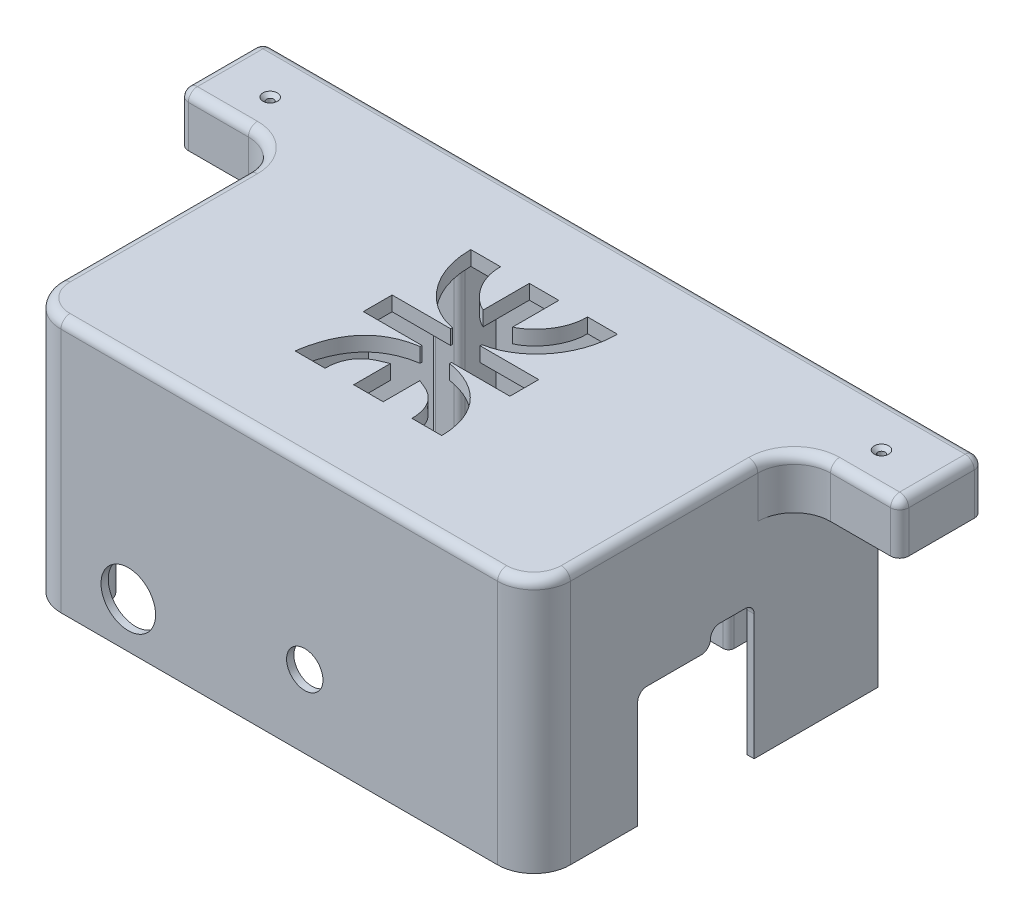
from build123d import *

# Parameters (mm, degrees)
SALIENTE_EXTRUIR1_DEPTH = 70
CORTAR_EXTRUIR1_START   = -70
CROQUIS2_W              = 29
CROQUIS2_H              = 23
CORTAR_EXTRUIR1_DEPTH   = 56
CROQUIS3_W              = 136
CROQUIS3_H              = 90.5
CORTAR_EXTRUIR2_DEPTH   = 66
REDONDEO5_R             = 10
REDONDEO13_R            = 2.5
REDONDEO14_R            = 10
REDONDEO15_R            = 10
CROQUIS7_W              = 15
CROQUIS7_H              = 13
CORTAR_EXTRUIR4_DEPTH   = 2
CORTAR_EXTRUIR5_DEPTH   = 140
REDONDEO16_R            = 2.5
REDONDEO17_R            = 2.5
CROQUIS9_R              = 7.5
CROQUIS9_R_2            = 5
CORTAR_EXTRUIR6_DEPTH   = 2
CROQUIS10_R             = 1
SALIENTE_EXTRUIR8_DEPTH = 66
CROQUIS10_4_R           = 1
CORTAR_EXTRUIR7_DEPTH   = 10
REDONDEO18_R            = 5
CROQUIS12_W             = 8.003042052
CROQUIS12_H             = 10
CROQUIS12_R             = 1
SALIENTE_EXTRUIR9_DEPTH = 66
CROQUIS12_3_R           = 1
CORTAR_EXTRUIR8_DEPTH   = 10
REDONDEO19_R            = 1.5
CORTAR_EXTRUIR9_REACH   = 136.7
CROQUIS13_R             = 1
REDONDEO20_R            = 2.5
CHAFL_N1_SIZE           = 1
CORTAR_EXTRUIR10_REACH  = 136.7


with BuildPart() as part:
    # Croquis1 → Saliente-Extruir1 (new body)
    with BuildSketch(Plane(origin=(0, 0, 0), x_dir=(1, 0, 0), z_dir=(0, 1, 0))):
        Polygon((-70, -35.821234201), (70, -35.821234201), (70, 35.678765799), (99, 35.678765799), (99, 58.678765799), (-99, 58.678765799), (-99, 35.678765799), (-70, 35.678765799), align=None)
    extrude(amount=SALIENTE_EXTRUIR1_DEPTH)

    # Croquis2 → Cortar-Extruir1 (cut)
    with BuildSketch(Plane(origin=(0, 70, 0), x_dir=(1, 0, 0), z_dir=(0, 1, 0)).offset(CORTAR_EXTRUIR1_START)):
        with Locations((-84.5, 47.178765799)):
            Rectangle(CROQUIS2_W, CROQUIS2_H)
        with Locations((84.5, 47.178765799)):
            Rectangle(CROQUIS2_W, CROQUIS2_H)
    extrude(amount=CORTAR_EXTRUIR1_DEPTH, mode=Mode.SUBTRACT)

    # Croquis3 → Cortar-Extruir2 (cut)
    with BuildSketch(Plane.XZ):
        with Locations((0, -11.428765799)):
            Rectangle(CROQUIS3_W, CROQUIS3_H)
    extrude(amount=-CORTAR_EXTRUIR2_DEPTH, mode=Mode.SUBTRACT)

    # Redondeo5
    redondeo5_edges = [part.edges().sort_by_distance(p)[0] for p in [
        (-70, 63, -35.678765799),
        (70, 63, -35.678765799),
    ]]
    fillet(redondeo5_edges, radius=REDONDEO5_R)

    # Redondeo13
    redondeo13_edges = [part.edges().sort_by_distance(p)[0] for p in [
        (-99, 63, -35.678765799),
        (-99, 63, -58.678765799),
        (99, 63, -58.678765799),
        (99, 63, -35.678765799),
    ]]
    fillet(redondeo13_edges, radius=REDONDEO13_R)

    # Redondeo14
    redondeo14_edges = [part.edges().sort_by_distance(p)[0] for p in [
        (-68, 33, 33.821234201),
        (68, 33, 33.821234201),
    ]]
    fillet(redondeo14_edges, radius=REDONDEO14_R)

    # Redondeo15
    redondeo15_edges = [part.edges().sort_by_distance(p)[0] for p in [
        (70, 35, 35.821234201),
        (-70, 35, 35.821234201),
    ]]
    fillet(redondeo15_edges, radius=REDONDEO15_R)

    # Croquis7 → Cortar-Extruir4 (cut)
    with BuildSketch(Plane(origin=(0, 0, -58.678765799), x_dir=(-1, 0, 0), z_dir=(0, 0, -1))):
        with Locations((0, 6.5)):
            Rectangle(CROQUIS7_W, CROQUIS7_H)
    extrude(amount=-CORTAR_EXTRUIR4_DEPTH, mode=Mode.SUBTRACT)

    # Croquis8 → Cortar-Extruir5 (cut)
    with BuildSketch(Plane.ZY.offset(70)):
        Polygon((-24.678765799, 0), (-24.678765799, 32), (-24.678765799, 37), (-12.678765799, 37), (-12.678765799, 32), (7.321234201, 32), (7.321234201, 0), align=None)
    extrude(amount=-CORTAR_EXTRUIR5_DEPTH, mode=Mode.SUBTRACT)

    # Redondeo16
    redondeo16_edges = [part.edges().sort_by_distance(p)[0] for p in [
        (-69, 32, -12.678765799),
        (-69, 32, 7.321234201),
        (-69, 37, -24.678765799),
        (-69, 37, -12.678765799),
    ]]
    fillet(redondeo16_edges, radius=REDONDEO16_R - 0.0001)  # a hair under: the kernel refuses the full size

    # Redondeo17
    redondeo17_edges = [part.edges().sort_by_distance(p)[0] for p in [
        (69, 37, -24.678765799),
        (69, 37, -12.678765799),
        (69, 32, -12.678765799),
        (69, 32, 7.321234201),
    ]]
    fillet(redondeo17_edges, radius=REDONDEO17_R - 0.0001)  # a hair under: the kernel refuses the full size

    # Croquis9 → Cortar-Extruir6 (cut)
    with BuildSketch(Plane.XY.offset(35.821234201)):
        with Locations((-41.5, 12.5)):
            Circle(CROQUIS9_R)
        with Locations((7, 20)):
            Circle(CROQUIS9_R_2)
    extrude(amount=-CORTAR_EXTRUIR6_DEPTH, mode=Mode.SUBTRACT)


with BuildPart() as saliente_extruir8_tool:
    # Croquis10 → Saliente-Extruir8 (new body)
    # profile 1 of 4: a face of its own
    with BuildSketch(Plane(origin=(0, 0, 0), x_dir=(1, 0, 0), z_dir=(0, 1, 0))):
        with BuildLine():
            ThreePointArc((-56, -33.821234201), (-65.071066479, -30.89230068), (-68, -21.821234201))
            Line((-68, -21.821234201), (-56, -21.821234201))
            Line((-56, -21.821234201), (-56, -33.821234201))
        make_face()
        with Locations((-62, -27.821234201)):
            Circle(CROQUIS10_R, mode=Mode.SUBTRACT)
    # profile 2 of 4: a face of its own
    with BuildSketch(Plane(origin=(0, 0, 0), x_dir=(1, 0, 0), z_dir=(0, 1, 0))):
        with Locations((-62, -27.821234201)):
            Circle(CROQUIS10_R)
    # profile 3 of 4: a face of its own
    with BuildSketch(Plane(origin=(0, 0, 0), x_dir=(1, 0, 0), z_dir=(0, 1, 0))):
        with BuildLine():
            Line((56, -33.821234201), (56, -21.821234201))
            Line((56, -21.821234201), (68, -21.821234201))
            ThreePointArc((68, -21.821234201), (65.071066479, -30.89230068), (56, -33.821234201))
        make_face()
        with Locations((62, -27.821234201)):
            Circle(CROQUIS10_R, mode=Mode.SUBTRACT)
    # profile 4 of 4: a face of its own
    with BuildSketch(Plane(origin=(0, 0, 0), x_dir=(1, 0, 0), z_dir=(0, 1, 0))):
        with Locations((62, -27.821234201)):
            Circle(CROQUIS10_R)
    extrude(amount=SALIENTE_EXTRUIR8_DEPTH)


with BuildPart() as part_1:
    add(part.part)


with BuildPart() as part_2:
    # Saliente-Extruir8: joined with saliente_extruir8_tool
    add(part_1.part.fuse(saliente_extruir8_tool.part, tol=0.00001))

    # Croquis10<4> → Cortar-Extruir7 (cut)
    with BuildSketch(Plane(origin=(0, 0, 0), x_dir=(1, 0, 0), z_dir=(0, 1, 0))):
        with Locations(Location((-62, -27.821234201, 0), (0, 0, 270))):
            Circle(CROQUIS10_4_R)
        with Locations(Location((62, -27.821234201, 0), (0, 0, 90))):
            Circle(CROQUIS10_4_R)
    extrude(amount=CORTAR_EXTRUIR7_DEPTH, mode=Mode.SUBTRACT)

    # Redondeo18
    redondeo18_edges = [part_2.edges().sort_by_distance(p)[0] for p in [
        (-56, 33, 21.821234201),
        (56, 33, 21.821234201),
    ]]
    fillet(redondeo18_edges, radius=REDONDEO18_R)

    # Croquis12 → Saliente-Extruir9 (add)
    # profile 1 of 4: a face of its own
    with BuildSketch(Plane(origin=(0, 0, 0), x_dir=(1, 0, 0), z_dir=(0, 1, 0))):
        with Locations((-36.998478974, 51.678765799)):
            Rectangle(CROQUIS12_W, CROQUIS12_H)
        with Locations((-37, 50.678765799)):
            Circle(CROQUIS12_R, mode=Mode.SUBTRACT)
    # profile 2 of 4: a face of its own
    with BuildSketch(Plane(origin=(0, 0, 0), x_dir=(1, 0, 0), z_dir=(0, 1, 0))):
        with Locations((-37, 50.678765799)):
            Circle(CROQUIS12_R)
    # profile 3 of 4: a face of its own
    with BuildSketch(Plane(origin=(0, 0, 0), x_dir=(1, 0, 0), z_dir=(0, 1, 0))):
        with Locations((36.998478974, 51.678765799)):
            Rectangle(CROQUIS12_W, CROQUIS12_H)
        with Locations((37, 50.678765799)):
            Circle(CROQUIS12_R, mode=Mode.SUBTRACT)
    # profile 4 of 4: a face of its own
    with BuildSketch(Plane(origin=(0, 0, 0), x_dir=(1, 0, 0), z_dir=(0, 1, 0))):
        with Locations((37, 50.678765799)):
            Circle(CROQUIS12_R)
    extrude(amount=SALIENTE_EXTRUIR9_DEPTH)

    # Croquis12<3> → Cortar-Extruir8 (cut)
    with BuildSketch(Plane(origin=(0, 0, 0), x_dir=(1, 0, 0), z_dir=(0, 1, 0))):
        with Locations(Location((-37, 50.678765799, 0), (0, 0, 270))):
            Circle(CROQUIS12_3_R)
        with Locations(Location((37, 50.678765799, 0), (0, 0, 90))):
            Circle(CROQUIS12_3_R)
    extrude(amount=CORTAR_EXTRUIR8_DEPTH, mode=Mode.SUBTRACT)

    # Redondeo19
    redondeo19_edges = [part_2.edges().sort_by_distance(p)[0] for p in [
        (-41, 33, -46.678765799),
        (-32.996957948, 33, -46.678765799),
        (41, 33, -46.678765799),
        (32.996957948, 33, -46.678765799),
    ]]
    fillet(redondeo19_edges, radius=REDONDEO19_R)

    # Croquis13 → Cortar-Extruir9 (cut, up to next)
    with BuildSketch(Plane(origin=(0, 70, 0), x_dir=(1, 0, 0), z_dir=(0, 1, 0)), mode=Mode.PRIVATE) as cortar_extruir9_sk1:
        with Locations(Location((-84, 45.678765799, 0), (0, 0, 270))):
            Circle(CROQUIS13_R)
    cortar_extruir9_tool1 = extrude(cortar_extruir9_sk1.sketch, amount=-CORTAR_EXTRUIR9_REACH, mode=Mode.PRIVATE) & part_2.part
    # Croquis13 → Cortar-Extruir9 (cut, up to next)
    with BuildSketch(Plane(origin=(0, 70, 0), x_dir=(1, 0, 0), z_dir=(0, 1, 0)), mode=Mode.PRIVATE) as cortar_extruir9_sk2:
        with Locations(Location((84, 45.678765799, 0), (0, 0, 270))):
            Circle(CROQUIS13_R)
    cortar_extruir9_tool2 = extrude(cortar_extruir9_sk2.sketch, amount=-CORTAR_EXTRUIR9_REACH, mode=Mode.PRIVATE) & part_2.part
    add(cortar_extruir9_tool1.solids().sort_by_distance((-84, 70, -45.678766))[0], mode=Mode.SUBTRACT)
    add(cortar_extruir9_tool2.solids().sort_by_distance((84, 70, -45.678766))[0], mode=Mode.SUBTRACT)

    # Redondeo20
    redondeo20_edges = [part_2.edges().sort_by_distance(p)[0] for p in [
        (70, 70, 0.071234201),
        (0, 70, 35.821234201),
        (-67.071067812, 70, 32.892302013),
        (67.071067812, 70, 32.892302013),
        (88.25, 70, -35.678765799),
        (-70, 70, 0.071234201),
        (72.928932188, 70, -32.749833611),
        (-72.928932188, 70, -32.749833611),
        (99, 70, -47.178765799),
        (-88.25, 70, -35.678765799),
        (0, 70, -58.678765799),
        (-99, 70, -47.178765799),
        (-98.267766953, 70, -36.410998846),
        (-98.267766953, 70, -57.946532752),
        (98.267766953, 70, -57.946532752),
        (98.267766953, 70, -36.410998846),
    ]]
    fillet(redondeo20_edges, radius=REDONDEO20_R)

    # Chaflán1
    chafl_n1_edges = [part_2.edges().sort_by_distance(p)[0] for p in [
        (-84, 70, -46.678765799),
        (84, 70, -46.678765799),
    ]]
    chamfer(chafl_n1_edges, length=CHAFL_N1_SIZE)

    # Croquis14 → Cortar-Extruir10 (cut, up to next)
    with BuildSketch(Plane(origin=(0, 70, 0), x_dir=(1, 0, 0), z_dir=(0, 1, 0)), mode=Mode.PRIVATE) as cortar_extruir10_sk1:
        with BuildLine():
            Line((-20.146838321, 36.956484824), (-11.95073101, 36.956484824))
            add(Edge.make_bspline(
                [(-4.057227177, 24.289864733), (-6.695826358, 25.256300103), (-12.074790019, 30.099684352), (-11.95073101, 36.956484824)],
                knots=[0, 0, 0, 0, 1, 1, 1, 1], degree=3))
            Line((-4.057227177, 24.289864733), (-4.057227177, 36.956484824))
            Line((-4.057227177, 36.956484824), (-0.004461878, 36.956484824))
            Line((-0.004461878, 36.956484824), (4.048303421, 36.956484824))
            Line((4.048303421, 36.956484824), (4.048303421, 24.289864733))
            add(Edge.make_bspline(
                [(4.048303421, 24.289864733), (6.686902602, 25.256300103), (12.065866263, 30.099684352), (11.941807254, 36.956484824)],
                knots=[0, 0, 0, 0, 1, 1, 1, 1], degree=3))
            Line((11.941807254, 36.956484824), (20.137914565, 36.956484824))
            add(Edge.make_bspline(
                [(20.137914565, 36.956484824), (20.18966101, 25.923210578), (12.570913778, 17.333037065), (4.048303421, 15.858130647)],
                knots=[0, 0, 0, 0, 1, 1, 1, 1], degree=3))
            Line((4.048303421, 15.858130647), (4.048303421, 15.340241278))
            Line((4.048303421, 15.340241278), (20.137914565, 15.340241278))
            Line((20.137914565, 15.340241278), (20.137914565, 7.422481759))
            Line((20.137914565, 7.422481759), (4.048303421, 7.422481759))
            Line((4.048303421, 7.422481759), (4.048303421, 6.913890274))
            add(Edge.make_bspline(
                [(4.048303421, 6.913890274), (13.268768878, 5.474688597), (20.063360811, -0.98235836), (20.137914565, -11.315515176)],
                knots=[0, 0, 0, 0, 1, 1, 1, 1], degree=3))
            Line((20.137914565, -11.315515176), (12.224292823, -11.315515176))
            Line((12.224292823, -11.315515176), (11.941807254, -11.315515176))
            add(Edge.make_bspline(
                [(4.05214205, -1.257632017), (5.359686174, -1.943634241), (11.876845008, -3.072276016), (11.941807254, -11.315515176)],
                knots=[0, 0, 0, 0, 1, 1, 1, 1], degree=3))
            Line((4.05214205, -1.257632017), (4.05214205, -11.315515176))
            Line((4.05214205, -11.315515176), (-4.061065806, -11.315515176))
            Line((-4.061065806, -11.315515176), (-4.061065806, -1.257632017))
            add(Edge.make_bspline(
                [(-4.061065806, -1.257632017), (-5.36860993, -1.943634241), (-11.885768764, -3.072276016), (-11.95073101, -11.315515176)],
                knots=[0, 0, 0, 0, 1, 1, 1, 1], degree=3))
            Line((-11.95073101, -11.315515176), (-12.233216579, -11.315515176))
            Line((-12.233216579, -11.315515176), (-20.146838321, -11.315515176))
            add(Edge.make_bspline(
                [(-4.057227177, 6.913890274), (-17.887925363, 4.755087759), (-20.146838321, -11.315515176)],
                knots=[0, 0, 0, 1, 1, 1], degree=2))
            Line((-4.057227177, 6.913890274), (-4.057227177, 7.422481759))
            Line((-4.057227177, 7.422481759), (-20.146838321, 7.422481759))
            Line((-20.146838321, 7.422481759), (-20.146838321, 15.340241278))
            Line((-20.146838321, 15.340241278), (-4.057227177, 15.340241278))
            Line((-4.057227177, 15.340241278), (-4.057227177, 15.858130647))
            add(Edge.make_bspline(
                [(-20.146838321, 36.956484824), (-20.198584766, 25.923210578), (-12.579837534, 17.333037065), (-4.057227177, 15.858130647)],
                knots=[0, 0, 0, 0, 1, 1, 1, 1], degree=3))
        make_face()
    cortar_extruir10_tool1 = extrude(cortar_extruir10_sk1.sketch, amount=-CORTAR_EXTRUIR10_REACH, mode=Mode.PRIVATE) & part_2.part
    add(cortar_extruir10_tool1.solids().sort_by_distance((0.076213, 70, -12.699632))[0], mode=Mode.SUBTRACT)


solid = part_2.part
